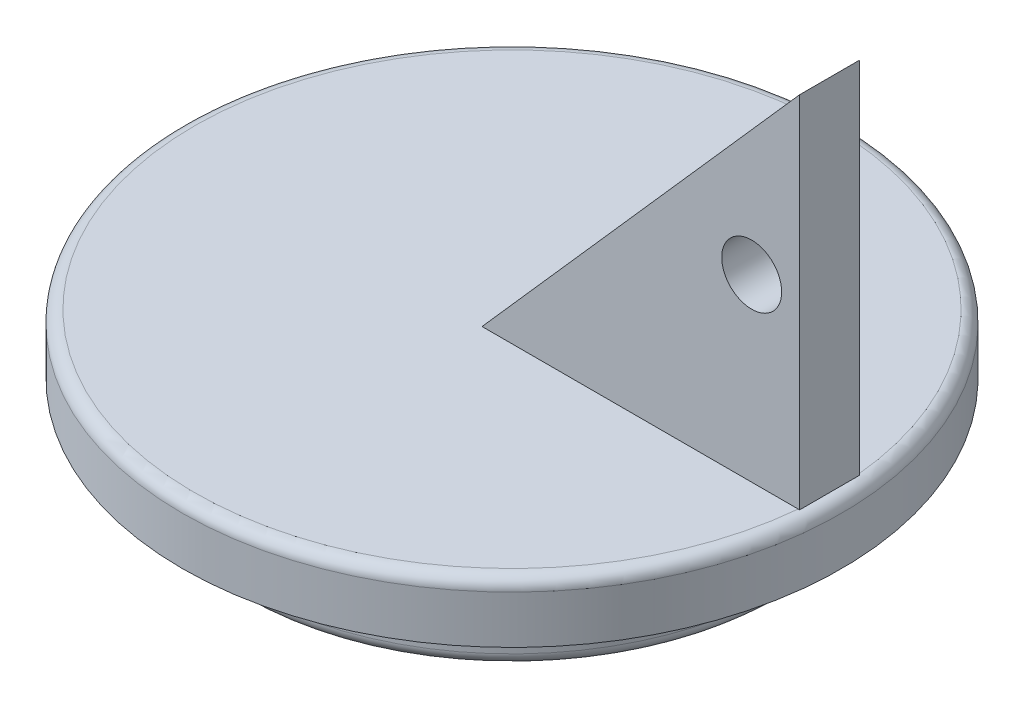
from build123d import *

# Parameters (mm, degrees)
FILLET1_R           = 1
SKETCH5_R           = 2.5
BOSS_EXTRUDE2_DEPTH = 2.5


with BuildPart() as part:
    # Sketch2 → Revolve1 (revolve)
    with BuildSketch(Plane.XY):
        Polygon((0, 0), (22.5, 0), (22.5, 5), (27.5, 5), (27.5, 10), (0, 10), align=None)
    revolve(axis=Axis((0, 10, 0), (0, -1, 0)))

    # Fillet1
    fillet1_edges = [part.edges().sort_by_distance(p)[0] for p in [
        (-27.5, 10, 0),
        (-22.5, 5, 0),
        (-22.5, 0, 0),
    ]]
    fillet(fillet1_edges, radius=FILLET1_R)

    # Sketch5 → Boss-Extrude2 (add, symmetric)
    with BuildSketch(Plane.XY):
        Polygon((26.5, 10), (26.5, 40), (0, 10), align=None)
        with Locations((22.5, 25)):
            Circle(SKETCH5_R, mode=Mode.SUBTRACT)
    extrude(amount=BOSS_EXTRUDE2_DEPTH, both=True)


solid = part.part
